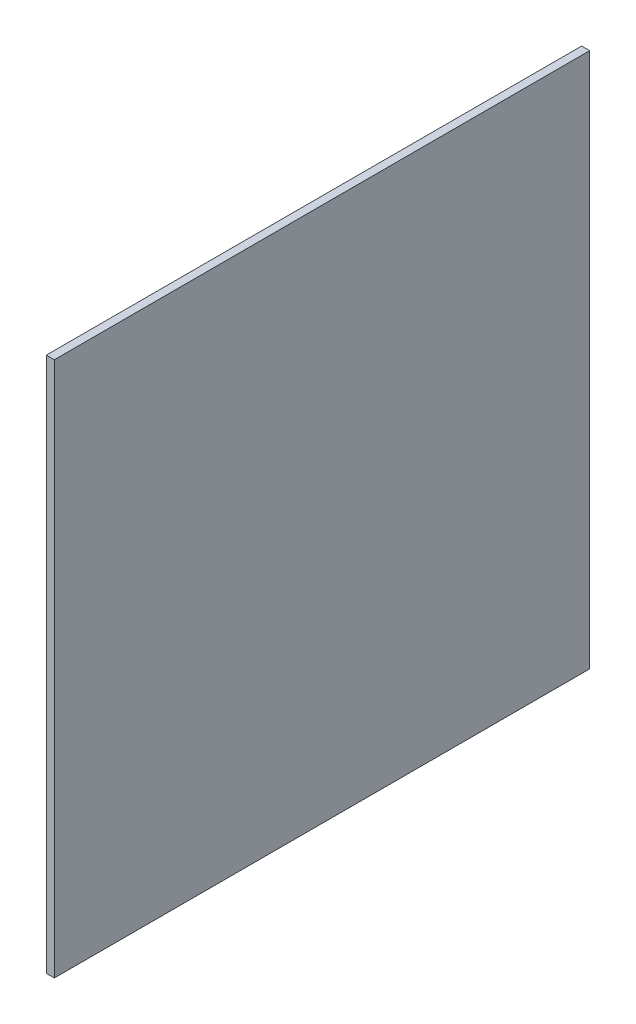
from build123d import *

# Parameters (mm, degrees)
SKETCH1_W           = 2000
SKETCH1_H           = 2000
BOSS_EXTRUDE1_DEPTH = 30


with BuildPart() as part:
    # Sketch1 → Boss-Extrude1 (new body)
    with BuildSketch(Plane(origin=(0, 0, 0), x_dir=(0, 0, -1), z_dir=(1, 0, 0))):
        Rectangle(SKETCH1_W, SKETCH1_H)
    extrude(amount=BOSS_EXTRUDE1_DEPTH)


solid = part.part
